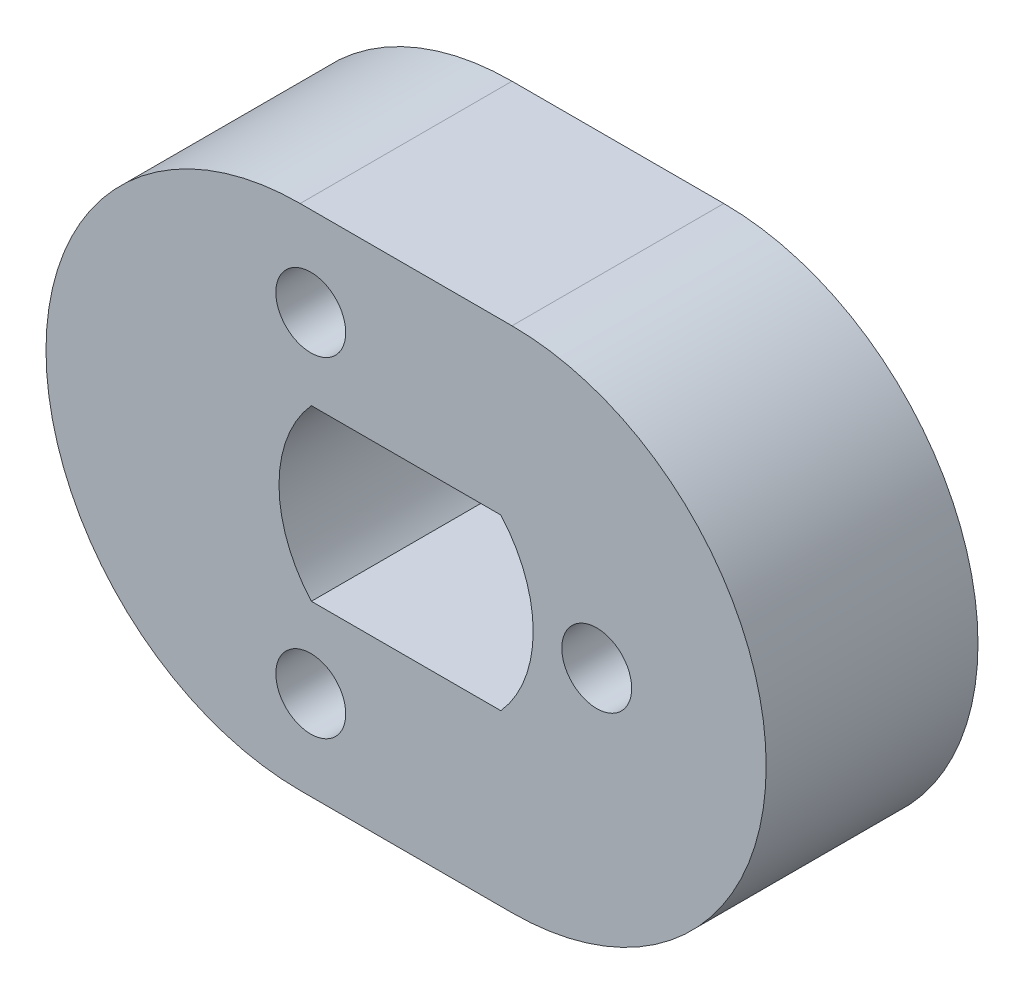
from build123d import *

# Parameters (mm, degrees)
SKETCH1_R           = 6
BOSS_EXTRUDE1_DEPTH = 10
M4_TAPPED_HOLE1_D   = 3.3
CIRPATTERN1_COUNT   = 3
BOSS_EXTRUDE2_START = -10
BOSS_EXTRUDE2_DEPTH = 10


with BuildPart() as part:
    # Sketch1 → Boss-Extrude1 (new body)
    with BuildSketch(Plane.XY):
        with BuildLine():
            Line((0, 12), (10, 12))
            ThreePointArc((10, 12), (22, 0), (10, -12))
            Line((10, -12), (0, -12))
            ThreePointArc((0, -12), (-12, 0), (0, 12))
        make_face()
        with Locations((5, 0)):
            Circle(SKETCH1_R, mode=Mode.SUBTRACT)
    extrude(amount=BOSS_EXTRUDE1_DEPTH)

    # M4 Tapped Hole1 (through all)
    with Locations(Plane(origin=(14, 0, 10), x_dir=(1, 0, 0), z_dir=(0, 0, 1))):
        with Locations((0, 0)):
            m4_tapped_hole1 = Hole(M4_TAPPED_HOLE1_D / 2)

    # CirPattern1: M4 Tapped Hole1 ×3 about axis
    cirpattern1_axis = Axis((5, 0, 10), (0, 0, 1))
    for i in range(1, CIRPATTERN1_COUNT):
        add(m4_tapped_hole1.rotate(cirpattern1_axis, i * 360 / CIRPATTERN1_COUNT), mode=Mode.SUBTRACT)

    # Sketch4 → Boss-Extrude2 (add)
    with BuildSketch(Plane.XY.offset(10).offset(BOSS_EXTRUDE2_START)):
        with BuildLine():
            ThreePointArc((9.472135955, 4), (5, 6), (0.527864045, 4))
            Line((0.527864045, 4), (9.472135955, 4))
        make_face()
        with BuildLine():
            Line((9.472135955, -4), (0.527864045, -4))
            ThreePointArc((0.527864045, -4), (5, -6), (9.472135955, -4))
        make_face()
    extrude(amount=BOSS_EXTRUDE2_DEPTH)


solid = part.part
